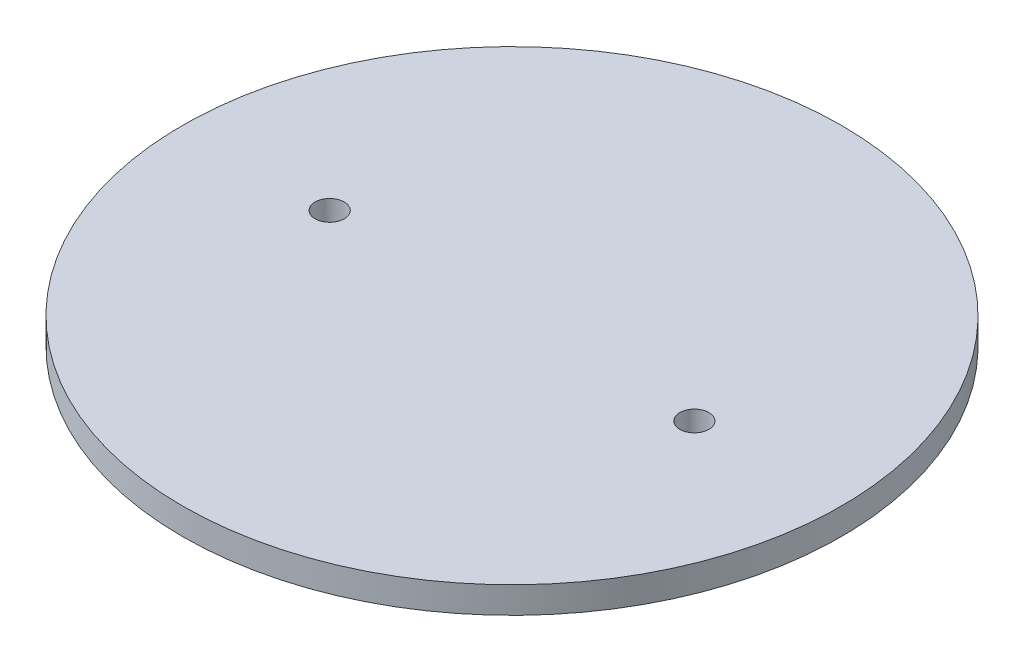
from build123d import *

# Parameters (mm, degrees)
SKETCH1_R           = 49.7
SKETCH1_R_2         = 2.2
BOSS_EXTRUDE1_DEPTH = 4


with BuildPart() as part:
    # Sketch1 → Boss-Extrude1 (new body)
    with BuildSketch(Plane(origin=(0, 0, 0), x_dir=(1, 0, 0), z_dir=(0, 1, 0))):
        Circle(SKETCH1_R)
        with Locations((-27.5, 0)):
            Circle(SKETCH1_R_2, mode=Mode.SUBTRACT)
        with Locations((27.5, 0)):
            Circle(SKETCH1_R_2, mode=Mode.SUBTRACT)
    extrude(amount=BOSS_EXTRUDE1_DEPTH)


solid = part.part
